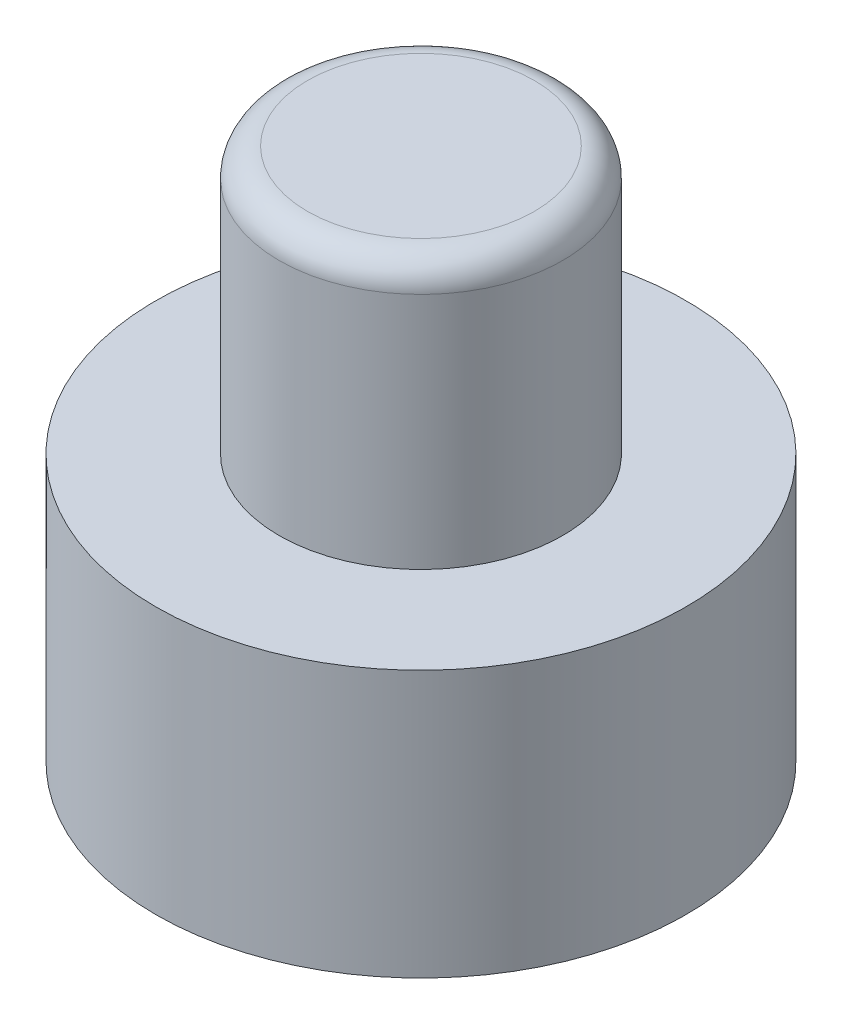
from build123d import *

# Parameters (mm, degrees)
SKETCH1_R           = 4.675
BOSS_EXTRUDE1_DEPTH = 4.7
SKETCH2_R           = 2.5
BOSS_EXTRUDE2_DEPTH = 4.7
FILLET1_R           = 0.5


with BuildPart() as part:
    # Sketch1 → Boss-Extrude1 (new body)
    with BuildSketch(Plane(origin=(0, 0, 0), x_dir=(1, 0, 0), z_dir=(0, 1, 0))):
        Circle(SKETCH1_R)
    extrude(amount=BOSS_EXTRUDE1_DEPTH)

    # Sketch2 → Boss-Extrude2 (add)
    with BuildSketch(Plane(origin=(0, 4.7, 0), x_dir=(1, 0, 0), z_dir=(0, 1, 0))):
        Circle(SKETCH2_R)
    extrude(amount=BOSS_EXTRUDE2_DEPTH)

    # Fillet1
    fillet1_edges = [part.edges().sort_by_distance(p)[0] for p in [
        (-2.5, 9.4, 0),
    ]]
    fillet(fillet1_edges, radius=FILLET1_R)


solid = part.part
